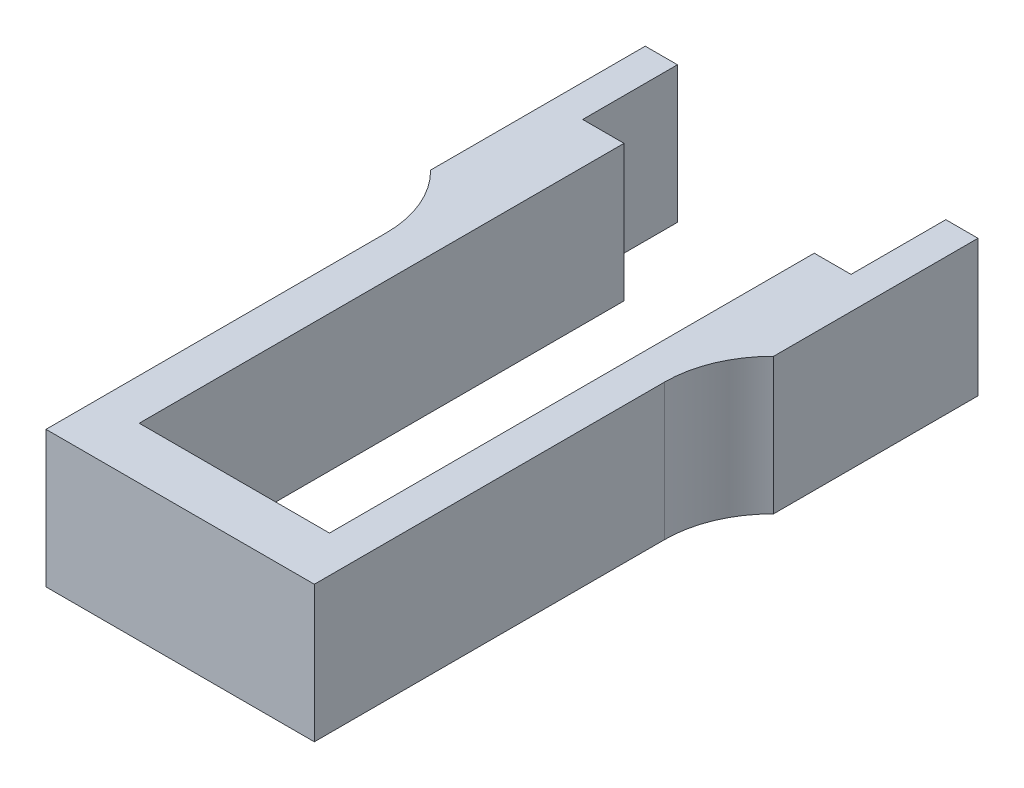
from build123d import *

# Parameters (mm, degrees)
SKETCH1_W           = 3.85
SKETCH1_H           = 12.714938244
BOSS_EXTRUDE1_DEPTH = 50
BOSS_EXTRUDE2_DEPTH = 12.714938244
SKETCH4_W           = 19.052451889
SKETCH4_H           = 12.714938244
BOSS_EXTRUDE3_DEPTH = 3
FILLET1_R           = 10
SKETCH5_W           = 19.999198202
SKETCH5_H           = 12.714938244
BOSS_EXTRUDE4_DEPTH = 3
FILLET2_R           = 10


with BuildPart() as part:
    # Sketch1 → Boss-Extrude1 (new body)
    with BuildSketch(Plane.XY):
        with Locations((-23.075, 79.148527214)):
            Rectangle(SKETCH1_W, SKETCH1_H)
    extrude(amount=BOSS_EXTRUDE1_DEPTH)

    # Sketch3 → Boss-Extrude2 (add)
    with BuildSketch(Plane(origin=(0, 85.505996336, 0), x_dir=(1, 0, 0), z_dir=(0, 1, 0))):
        Polygon((-21.15, -45.165463377), (-3.42398491, -45.165463377), (-3.42398491, 0), (0, 0), (0, -50), (-21.15, -50), align=None)
    extrude(amount=-BOSS_EXTRUDE2_DEPTH)

    # Sketch4 → Boss-Extrude3 (add)
    with BuildSketch(Plane(origin=(0, 0, 0), x_dir=(0, 0, -1), z_dir=(1, 0, 0))):
        with Locations((-0.697437539, 79.148527214)):
            Rectangle(SKETCH4_W, SKETCH4_H)
    extrude(amount=BOSS_EXTRUDE3_DEPTH)

    # Fillet1
    # the kernel refuses this fillet: 10 mm, written as the material it adds along each edge
    with BuildSketch(Plane(origin=(0, 72.791058092, 10.223663483), x_dir=(0, 0, 1), z_dir=(0, 1, 0))) as fillet1_piece_1:
        with BuildLine():
            CenterArc((7.141428429, 10), FILLET1_R, 224.427004001, 45.572995999)
            Line((0, 3), (-0.142828569, 2.86))
            ThreePointArc((-0.142828569, 2.86), (-0.2, 1.5), (-0.2, 0))
            Line((-0.2, 0), (0, -0.2))
            Line((0, -0.2), (7.141428429, -0.2))
            Line((7.141428429, -0.2), (7.141428429, 0))
        make_face()
    extrude(amount=12.714938244)

    # Sketch5 → Boss-Extrude4 (add)
    with BuildSketch(Plane.ZY.offset(25)):
        with Locations((1.170810695, 79.148527214)):
            Rectangle(SKETCH5_W, SKETCH5_H)
    extrude(amount=BOSS_EXTRUDE4_DEPTH)

    # Fillet2
    # the kernel refuses this fillet: 10 mm, written as the material it adds along each edge
    with BuildSketch(Plane(origin=(-25, 72.791058092, 11.170409796), x_dir=(0, 0, 1), z_dir=(0, 1, 0))) as fillet2_piece_1:
        with BuildLine():
            CenterArc((7.141428429, -10), FILLET2_R, 90, 45.572995999)
            Line((0, -3), (-0.142828569, -2.86))
            ThreePointArc((-0.142828569, -2.86), (-0.2, -1.5), (-0.2, 0))
            Line((-0.2, 0), (0, 0.2))
            Line((0, 0.2), (7.141428429, 0.2))
            Line((7.141428429, 0.2), (7.141428429, 0))
        make_face()
    extrude(amount=12.714938244)


solid = part.part
